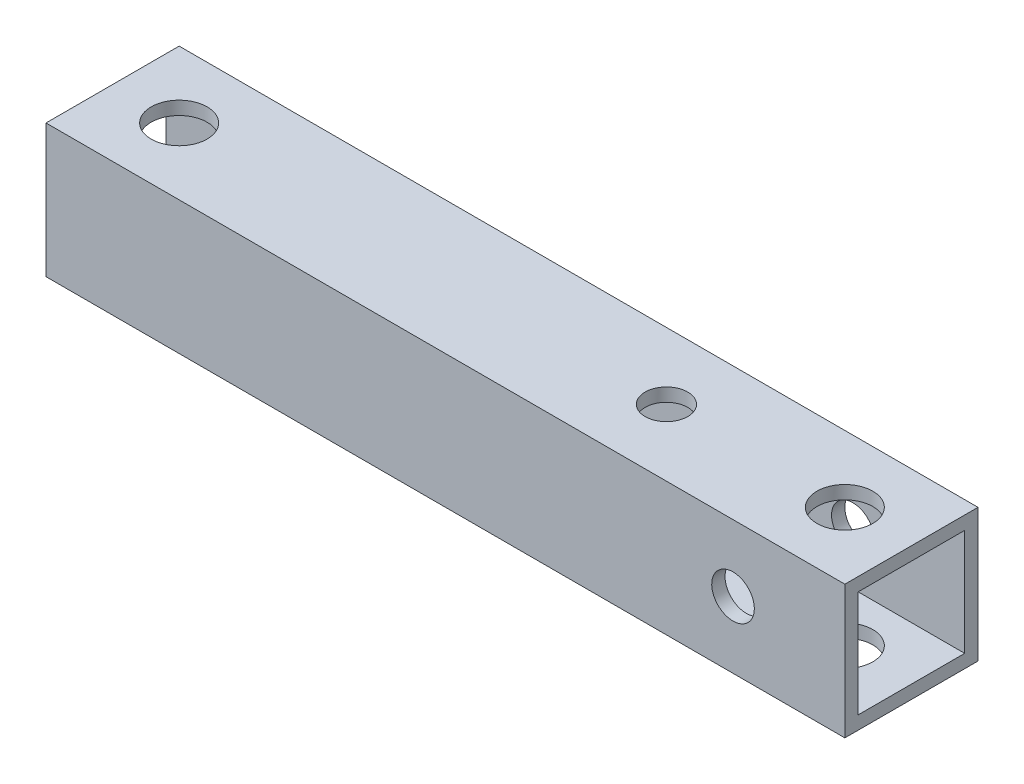
from build123d import *

# Parameters (mm, degrees)
SKETCH_1_W          = 10
SKETCH_1_H          = 10
SKETCH_1_W_2        = 8
SKETCH_1_H_2        = 8
EXTRUDE_1_DEPTH     = 60
SKETCH_2_R          = 2.1
SKETCH_2_R_2        = 1.6
CUT_EXTRUDE_1_DEPTH = 62.032778079
SKETCH_3_R          = 1.6
CUT_EXTRUDE_2_DEPTH = 62.032778079


with BuildPart() as part:
    # ｽｹｯﾁ1 → 押し出し-薄板1 (new body)
    with BuildSketch(Plane(origin=(0, 0, 0), x_dir=(0, 0, -1), z_dir=(1, 0, 0))):
        Rectangle(SKETCH_1_W, SKETCH_1_H)
        Rectangle(SKETCH_1_W_2, SKETCH_1_H_2, mode=Mode.SUBTRACT)
    extrude(amount=EXTRUDE_1_DEPTH)

    # ｽｹｯﾁ2 → ｶｯﾄ - 押し出し1 (cut, through all)
    with BuildSketch(Plane(origin=(0, 5, 0), x_dir=(1, 0, 0), z_dir=(0, 1, 0))):
        with Locations((55, 0)):
            Circle(SKETCH_2_R)
        with Locations((5, 0)):
            Circle(SKETCH_2_R)
        with Locations((41.6, 0)):
            Circle(SKETCH_2_R_2)
    extrude(amount=-CUT_EXTRUDE_1_DEPTH, mode=Mode.SUBTRACT)

    # ｽｹｯﾁ3 → ｶｯﾄ - 押し出し2 (cut, through all)
    with BuildSketch(Plane(origin=(0, 0, -5), x_dir=(-1, 0, 0), z_dir=(0, 0, -1))):
        with Locations((-51.6, 0)):
            Circle(SKETCH_3_R)
    extrude(amount=-CUT_EXTRUDE_2_DEPTH, mode=Mode.SUBTRACT)


solid = part.part
